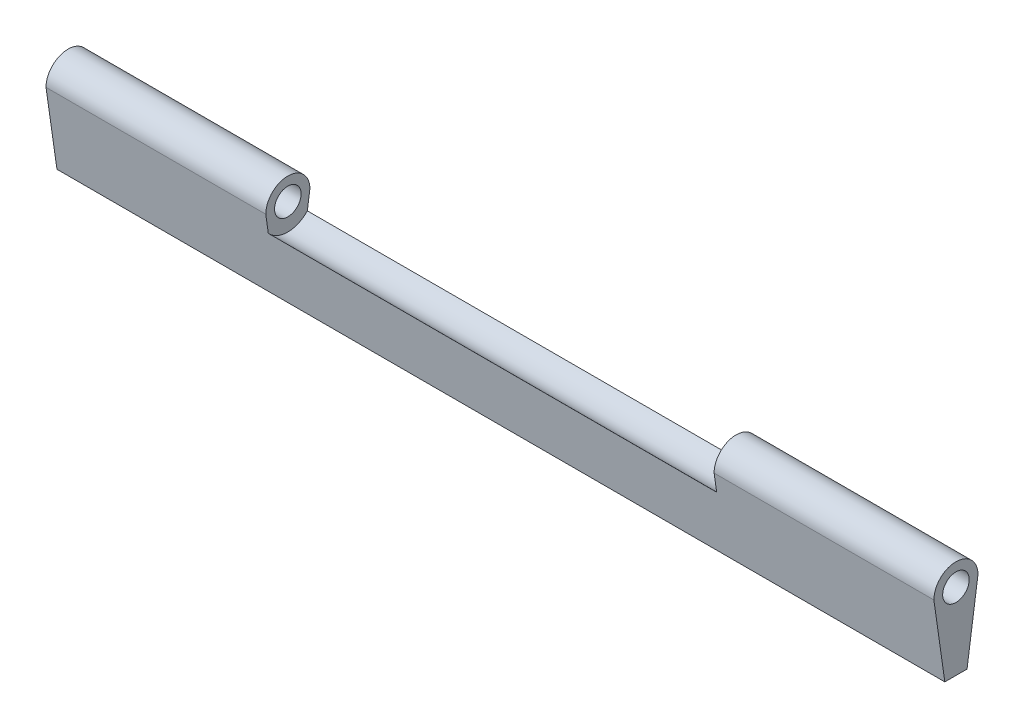
from build123d import *

# Parameters (mm, degrees)
SKETCH1_R           = 1.51
BOSS_EXTRUDE1_DEPTH = 25
BOSS_EXTRUDE2_DEPTH = 51
SKETCH3_R           = 1.51
BOSS_EXTRUDE3_DEPTH = 25


with BuildPart() as part:
    # Sketch1 → Boss-Extrude1 (new body)
    with BuildSketch(Plane(origin=(0, 0, 0), x_dir=(0, 0, -1), z_dir=(1, 0, 0))):
        with BuildLine():
            Line((1.263441005, -8.7), (2.51, 0))
            ThreePointArc((2.51, 0), (0, 2.51), (-2.51, 0))
            Line((-2.51, 0), (-1.263441005, -8.7))
            Line((-1.263441005, -8.7), (1.263441005, -8.7))
        make_face()
        Circle(SKETCH1_R, mode=Mode.SUBTRACT)
    extrude(amount=BOSS_EXTRUDE1_DEPTH)

    # Sketch2 → Boss-Extrude2 (add)
    with BuildSketch(Plane(origin=(25, 0, 0), x_dir=(0, 0, -1), z_dir=(1, 0, 0))):
        with BuildLine():
            Line((-1.263441005, -8.7), (1.263441005, -8.7))
            Line((1.263441005, -8.7), (2.218524627, -2.034268536))
            ThreePointArc((2.218524627, -2.034268536), (0, -3.01), (-2.218524627, -2.034268536))
            Line((-2.218524627, -2.034268536), (-1.263441005, -8.7))
        make_face()
    extrude(amount=BOSS_EXTRUDE2_DEPTH)

    # Sketch3 → Boss-Extrude3 (add)
    with BuildSketch(Plane(origin=(76, 0, 0), x_dir=(0, 0, -1), z_dir=(1, 0, 0))):
        with BuildLine():
            Line((-2.51, 0), (-1.263441005, -8.7))
            Line((-1.263441005, -8.7), (1.263441005, -8.7))
            Line((1.263441005, -8.7), (2.51, 0))
            ThreePointArc((2.51, 0), (0, 2.51), (-2.51, 0))
        make_face()
        Circle(SKETCH3_R, mode=Mode.SUBTRACT)
    extrude(amount=BOSS_EXTRUDE3_DEPTH)


solid = part.part
